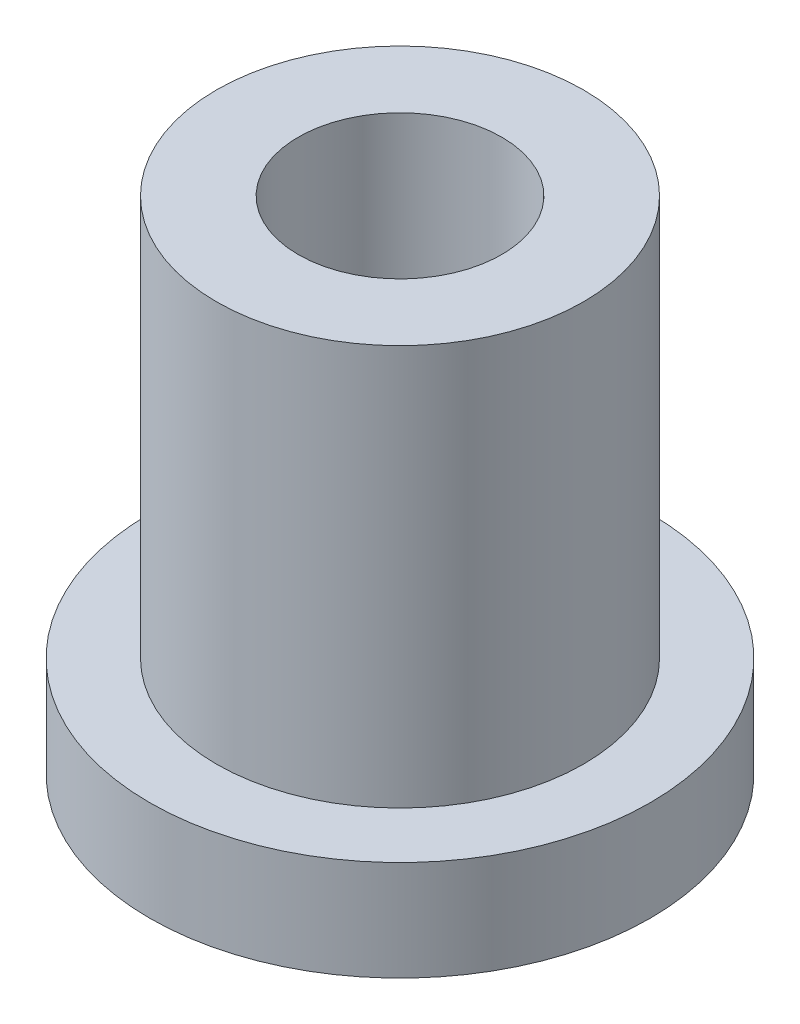
from build123d import *

# Parameters (mm, degrees)
SKETCH1_R           = 7.5
SKETCH1_R_2         = 3.05
BOSS_EXTRUDE1_DEPTH = 3
CIRPATTERN1_COUNT   = 10
SKETCH4_R           = 5.5
SKETCH4_R_2         = 3.05
BOSS_EXTRUDE2_DEPTH = 12


with BuildPart() as part:
    # Sketch1 → Boss-Extrude1 (new body)
    with BuildSketch(Plane(origin=(0, 0, 0), x_dir=(1, 0, 0), z_dir=(0, 1, 0))):
        Circle(SKETCH1_R)
        Circle(SKETCH1_R_2, mode=Mode.SUBTRACT)
    extrude(amount=BOSS_EXTRUDE1_DEPTH)

    # Sketch3 → Revolve2 (revolve)
    with BuildSketch(Plane(origin=(0, 0, 0), x_dir=(0, 0, -1), z_dir=(1, 0, 0))):
        with BuildLine():
            Line((4.35, 0), (5.75, 0))
            ThreePointArc((5.75, 0), (5.05, -0.7), (4.35, 0))
        make_face()
    revolve2 = revolve(axis=Axis((0, 0, -8.25), (0, 0, 1)))

    # CirPattern1: Revolve2 ×10 about axis
    cirpattern1_axis = Axis((0, -0.885, 0), (0, 1, 0))
    for i in range(1, CIRPATTERN1_COUNT):
        add(revolve2.rotate(cirpattern1_axis, i * 360 / CIRPATTERN1_COUNT))

    # Sketch4 → Boss-Extrude2 (add)
    with BuildSketch(Plane(origin=(0, 3, 0), x_dir=(1, 0, 0), z_dir=(0, 1, 0))):
        Circle(SKETCH4_R)
        Circle(SKETCH4_R_2, mode=Mode.SUBTRACT)
    extrude(amount=BOSS_EXTRUDE2_DEPTH)


solid = part.part
